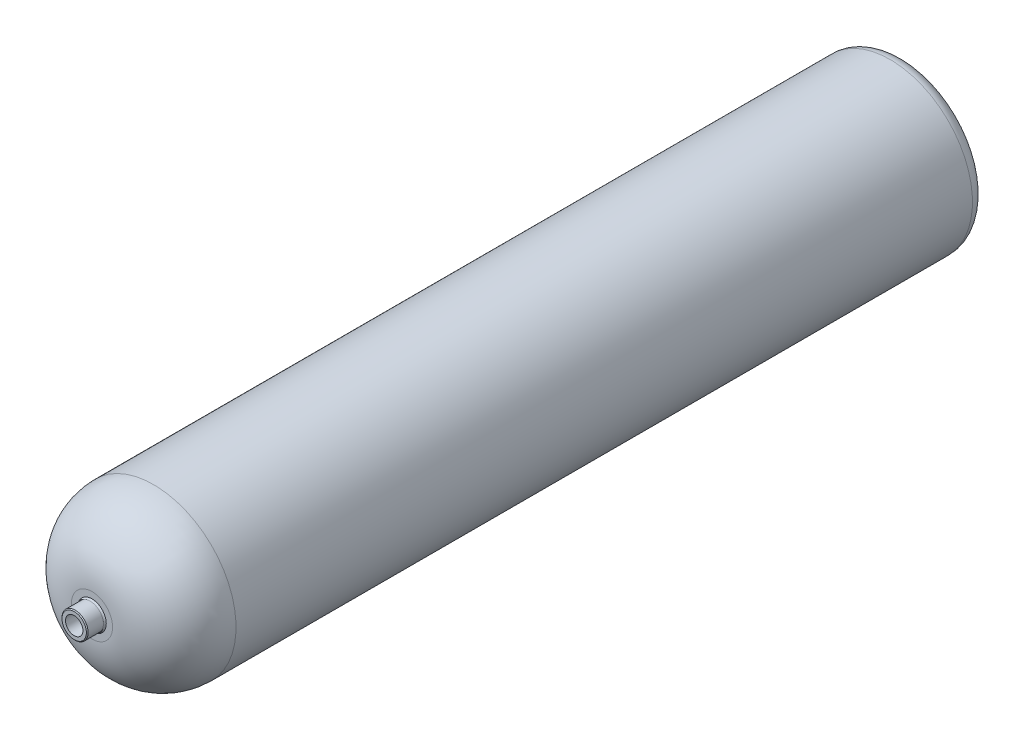
from build123d import *

# Parameters (mm, degrees)
BOSS_EXTRUDE1_DEPTH      = 355.6
BOSS_EXTRUDE1_DEPTH_BACK = 254
SKETCH1_R                = 66.04
FILLET1_R                = 12.7
SKETCH3_R                = 12.7
CUT_EXTRUDE1_DEPTH       = 25.4
CHAMFER1_SIZE            = 1.27
FILLET2_R                = 2.54
BOSS_EXTRUDE2_DEPTH      = 600
BOSS_EXTRUDE2_DEPTH_BACK = 583.65
SKETCH4_R                = 120
FILLET3_R                = 20
FILLET4_R                = 90


# Read off the part's stored shape, not the designer's step: Shell1
with BuildPart() as part:
    # Sketch1 → Boss-Extrude1 (new, two sides: drawn at the far end of the back side and taken through both)
    with BuildSketch(Plane.XY.offset(-BOSS_EXTRUDE1_DEPTH_BACK)):
        Circle(SKETCH1_R)
    extrude(amount=BOSS_EXTRUDE1_DEPTH + BOSS_EXTRUDE1_DEPTH_BACK)

    # Sketch2 → Cut-Revolve1 (revolve, cut)
    with BuildSketch(Plane(origin=(0, 0, 0), x_dir=(0, 0, -1), z_dir=(1, 0, 0)), mode=Mode.PRIVATE) as cut_revolve1_sk:
        with BuildLine():
            Line((-355.6, 19.05), (-330.2, 19.05))
            ThreePointArc((-330.2, 19.05), (-306.35774098, 53.006337357), (-266.967262435, 66.04))
            Line((-266.967262435, 66.04), (-355.6, 66.04))
            Line((-355.6, 66.04), (-355.6, 19.05))
        make_face()
    revolve(cut_revolve1_sk.sketch.rotate(Axis((0, 0, 355.6), (0, 0, -1)), 90), axis=Axis((0, 0, 355.6), (0, 0, -1)), mode=Mode.SUBTRACT)

    # Fillet1
    fillet1_edges = [part.edges().sort_by_distance(p)[0] for p in [
        (-66.04, 0, -254),
    ]]
    fillet(fillet1_edges, radius=FILLET1_R)

    # Sketch3 → Cut-Extrude1 (cut)
    with BuildSketch(Plane.XY.offset(355.6)):
        Circle(SKETCH3_R)
    extrude(amount=-CUT_EXTRUDE1_DEPTH, mode=Mode.SUBTRACT)

    # Shell1 outline → Shell1 (revolve, cut)
    with BuildSketch(Plane.XZ):
        with BuildLine():
            Line((0, -247.65), (53.34, -247.65))
            ThreePointArc((53.34, -247.65), (57.830128061, -245.790128061), (59.69, -241.3))
            Line((59.69, -241.3), (59.69, 266.967262375))
            ThreePointArc((59.69, 266.967262375), (46.480959005, 304.416114887), (12.699999942, 325.290551964))
            Line((12.699999942, 325.290551964), (12.7, 330.2))
            Line((12.7, 330.2), (0, 330.2))
            Line((0, 330.2), (0, -247.65))
        make_face()
    revolve(axis=Axis((0, 0, 0), (0, 0, 1)), mode=Mode.SUBTRACT)

    # Chamfer1
    chamfer1_edges = [part.edges().sort_by_distance(p)[0] for p in [
        (-19.05, 0, 355.6),
    ]]
    chamfer(chamfer1_edges, length=CHAMFER1_SIZE)

    # Fillet2
    fillet2_edges = [part.edges().sort_by_distance(p)[0] for p in [
        (-19.05, 0, 330.2),
    ]]
    fillet(fillet2_edges, radius=FILLET2_R)

    # Sketch4 → Boss-Extrude2 (add, two sides: drawn at the far end of the back side and taken through both)
    with BuildSketch(Plane(origin=(0, 0, -254), x_dir=(-1, 0, 0), z_dir=(0, 0, -1)).offset(-BOSS_EXTRUDE2_DEPTH_BACK)):
        Circle(SKETCH4_R)
    extrude(amount=BOSS_EXTRUDE2_DEPTH + BOSS_EXTRUDE2_DEPTH_BACK)

    # Fillet3
    fillet3_edges = [part.edges().sort_by_distance(p)[0] for p in [
        (120, 0, -854),
    ]]
    fillet(fillet3_edges, radius=FILLET3_R)

    # Fillet4
    fillet4_edges = [part.edges().sort_by_distance(p)[0] for p in [
        (120, 0, 329.65),
    ]]
    fillet(fillet4_edges, radius=FILLET4_R)


solid = part.part
